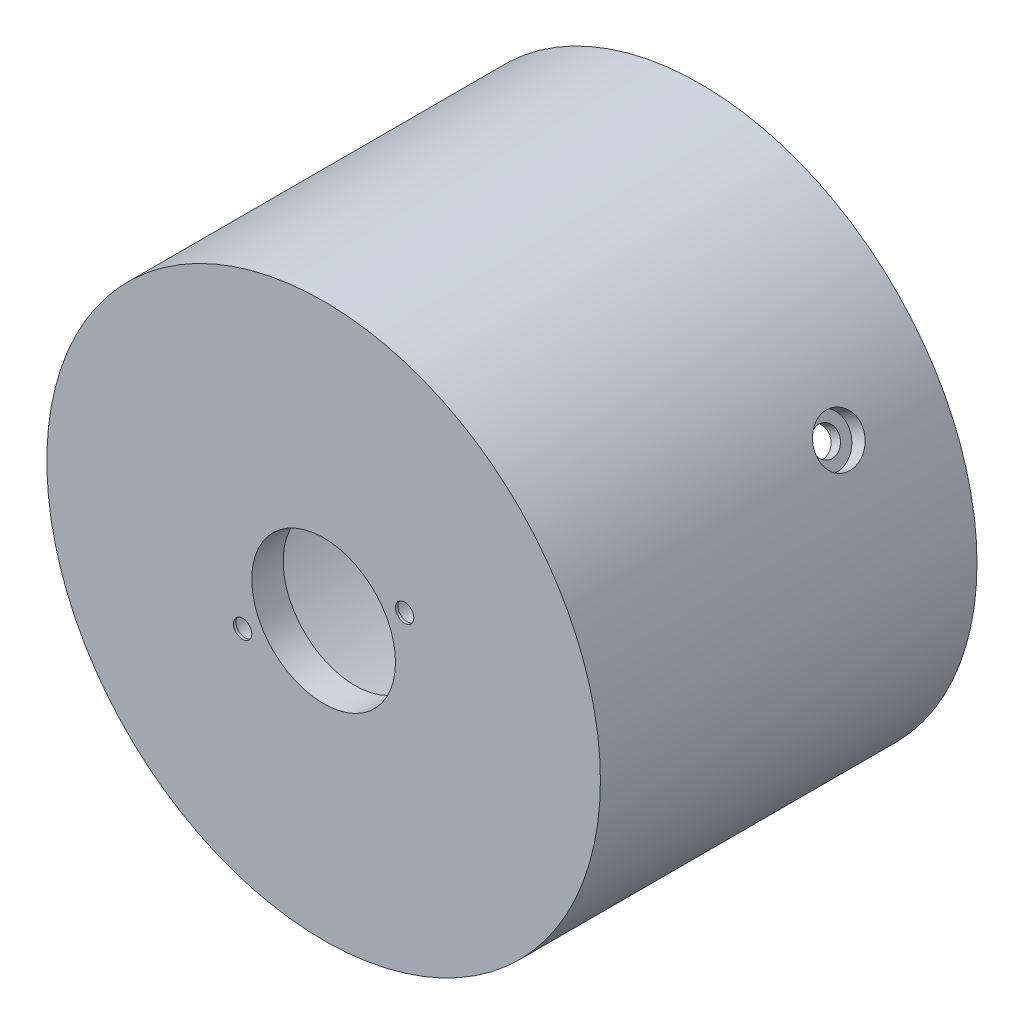
from build123d import *

# Parameters (mm, degrees)
SKETCH1_R                                   = 28.0035
SKETCH1_R_2                                 = 25.3365
BOSS_EXTRUDE1_DEPTH                         = 38.1
BOSS_EXTRUDE2_START                         = -3.175
SKETCH10_R                                  = 28.0035
BOSS_EXTRUDE2_DEPTH                         = 3.175
CBORE_START                                 = -28.003500075
CBORE_FOR_2_PAN_HEAD_MACHINE_SCREW1_OUT_R   = 2.38125
CBORE_FOR_2_PAN_HEAD_MACHINE_SCREW1_DEPTH   = 1.574800075
CBORE_START_2                               = -26.4287
CBORE_FOR_2_PAN_HEAD_MACHINE_SCREW1_2_O_R   = 1.35255
CBORE_FOR_2_PAN_HEAD_MACHINE_SCREW1_2_DEPTH = 1.128327756
CBORE_START_3                               = 26.4287
CBORE_FOR_2_PAN_HEAD_MACHINE_SCREW2_OUT_R   = 2.38125
CBORE_FOR_2_PAN_HEAD_MACHINE_SCREW2_DEPTH   = 1.574800075
CBORE_START_4                               = 25.300372244
CBORE_FOR_2_PAN_HEAD_MACHINE_SCREW2_2_O_R   = 1.35255
CBORE_FOR_2_PAN_HEAD_MACHINE_SCREW2_2_DEPTH = 1.128327756
CBORE_START_5                               = -28.003500101
CBORE_FOR_2_PAN_HEAD_MACHINE_SCREW3_OUT_R   = 2.38125
CBORE_FOR_2_PAN_HEAD_MACHINE_SCREW3_DEPTH   = 1.574800101
CBORE_FOR_2_PAN_HEAD_MACHINE_SCREW3_2_O_R   = 1.35255
CBORE_FOR_2_PAN_HEAD_MACHINE_SCREW3_2_DEPTH = 1.128327733
CUT_EXTRUDE1_REACH                          = 56.955
SKETCH20_R                                  = 7.27
HOLE1_AT_2_COUNT                            = 2
HOLE1_AT_2_PITCH                            = 19
F_0_CLEARANCE_HOLE1_D                       = 1.8542
CHAMFER1_SIZE                               = 1.27


# Read off the part's stored shape, not the designer's step: CBORE for #2 Pan Head Machine Screw1, CBORE for #2 Pan Head Machine Screw2, CBORE for #2 Pan Head Machine Screw3
with BuildPart() as part:
    # Sketch1 → Boss-Extrude1 (new body)
    with BuildSketch(Plane.XY):
        with Locations(Location((0, 0, 0), (0, 0, 180))):
            Circle(SKETCH1_R)
        with Locations(Location((0, 0, 0), (0, 0, 180))):
            Circle(SKETCH1_R_2, mode=Mode.SUBTRACT)
    extrude(amount=BOSS_EXTRUDE1_DEPTH)

    # Sketch10 → Boss-Extrude2 (add)
    with BuildSketch(Plane.XY.offset(38.1).offset(BOSS_EXTRUDE2_START)):
        with Locations(Location((0, 0, 0), (0, 0, 180))):
            Circle(SKETCH10_R)
    extrude(amount=BOSS_EXTRUDE2_DEPTH)

    # CBORE for #2 Pan Head Machine Screw1 out → CBORE for #2 Pan Head Machine Screw1 (cut)
    with BuildSketch(Plane(origin=(0, 0, 0), x_dir=(0.500000000000004, 0.8660254037844363, 0), z_dir=(0.8660254037844363, -0.5000000000000042, 0)).offset(CBORE_START)):
        with Locations((0, 10.2108)):
            Circle(CBORE_FOR_2_PAN_HEAD_MACHINE_SCREW1_OUT_R)
    extrude(amount=CBORE_FOR_2_PAN_HEAD_MACHINE_SCREW1_DEPTH, mode=Mode.SUBTRACT)

    # CBORE for _2 Pan Head Machine Screw1 2 o → CBORE for _2 Pan Head Machine Screw1 2 (cut)
    with BuildSketch(Plane(origin=(0, 0, 0), x_dir=(0.500000000000004, 0.8660254037844363, 0), z_dir=(0.8660254037844363, -0.5000000000000042, 0)).offset(CBORE_START_2)):
        with Locations((0, 10.2108)):
            Circle(CBORE_FOR_2_PAN_HEAD_MACHINE_SCREW1_2_O_R)
    extrude(amount=CBORE_FOR_2_PAN_HEAD_MACHINE_SCREW1_2_DEPTH, mode=Mode.SUBTRACT)

    # CBORE for #2 Pan Head Machine Screw2 out → CBORE for #2 Pan Head Machine Screw2 (cut)
    with BuildSketch(Plane(origin=(0, 0, 0), x_dir=(0.500000000000004, -0.8660254037844363, 0), z_dir=(0.8660254037844363, 0.5000000000000042, 0)).offset(CBORE_START_3)):
        with Locations((0, -10.2108)):
            Circle(CBORE_FOR_2_PAN_HEAD_MACHINE_SCREW2_OUT_R)
    extrude(amount=CBORE_FOR_2_PAN_HEAD_MACHINE_SCREW2_DEPTH, mode=Mode.SUBTRACT)

    # CBORE for _2 Pan Head Machine Screw2 2 o → CBORE for _2 Pan Head Machine Screw2 2 (cut)
    with BuildSketch(Plane(origin=(0, 0, 0), x_dir=(0.500000000000004, -0.8660254037844363, 0), z_dir=(0.8660254037844363, 0.5000000000000042, 0)).offset(CBORE_START_4)):
        with Locations((0, -10.2108)):
            Circle(CBORE_FOR_2_PAN_HEAD_MACHINE_SCREW2_2_O_R)
    extrude(amount=CBORE_FOR_2_PAN_HEAD_MACHINE_SCREW2_2_DEPTH, mode=Mode.SUBTRACT)

    # CBORE for #2 Pan Head Machine Screw3 out → CBORE for #2 Pan Head Machine Screw3 (cut)
    with BuildSketch(Plane(origin=(0, 0, 0), x_dir=(1, 0, 0), z_dir=(0, 1, 0)).offset(CBORE_START_5)):
        with Locations((0, -10.2108)):
            Circle(CBORE_FOR_2_PAN_HEAD_MACHINE_SCREW3_OUT_R)
    extrude(amount=CBORE_FOR_2_PAN_HEAD_MACHINE_SCREW3_DEPTH, mode=Mode.SUBTRACT)

    # CBORE for _2 Pan Head Machine Screw3 2 o → CBORE for _2 Pan Head Machine Screw3 2 (cut)
    with BuildSketch(Plane(origin=(0, 0, 0), x_dir=(1, 0, 0), z_dir=(0, 1, 0)).offset(CBORE_START_2)):
        with Locations((0, -10.2108)):
            Circle(CBORE_FOR_2_PAN_HEAD_MACHINE_SCREW3_2_O_R)
    extrude(amount=CBORE_FOR_2_PAN_HEAD_MACHINE_SCREW3_2_DEPTH, mode=Mode.SUBTRACT)

    # Sketch20 → Cut-Extrude1 (cut, up to next)
    with BuildSketch(Plane.XY.offset(38.1), mode=Mode.PRIVATE) as cut_extrude1_sk1:
        Circle(SKETCH20_R)
    cut_extrude1_tool1 = extrude(cut_extrude1_sk1.sketch, amount=-CUT_EXTRUDE1_REACH, mode=Mode.PRIVATE) & part.part
    add(cut_extrude1_tool1.solids().sort_by_distance((0, 0, 38.1))[0], mode=Mode.SUBTRACT)

    # Sketch22 → Hole1 (revolve, cut)
    with BuildSketch(Plane(origin=(8.195734173, 4.804158758, 34.925), x_dir=(0, 1, 0), z_dir=(1, 0, 0))):
        Polygon((0, 0), (0, 2.921), (1.4986, 2.921), (1.6383, 0), align=None)
    hole1 = revolve(axis=Axis((8.195734173, 4.804158758, 144.925), (0, 0, -1)), mode=Mode.SUBTRACT)

    # Hole1 at 2: Hole1 ×2
    with Locations(*[Vector(-0.8627088602819588, -0.5057009218807137, 0) * (i * HOLE1_AT_2_PITCH) for i in range(1, HOLE1_AT_2_COUNT)]):
        add(hole1, mode=Mode.SUBTRACT)

    # #0 Clearance Hole1 (through all)
    with Locations(Plane(origin=(0, 0, 34.925), x_dir=(-1, 0, 0), z_dir=(0, 0, -1))):
        with Locations((-8.195734173, 4.804158758), (8.195734173, -4.804158758)):
            Hole(F_0_CLEARANCE_HOLE1_D / 2)

    # Chamfer1
    chamfer1_edges = [part.edges().sort_by_distance(p)[0] for p in [
        (25.3365, 0, 0),
    ]]
    chamfer(chamfer1_edges, length=CHAMFER1_SIZE)


solid = part.part
